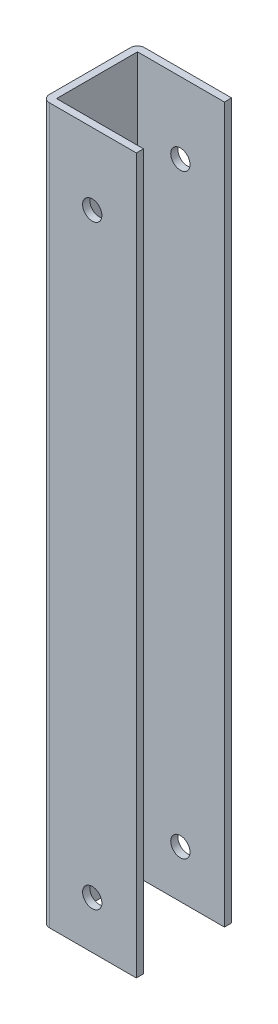
from build123d import *

# Parameters (mm, degrees)
SKETCH_1_W          = 74
SKETCH_1_H          = 34
EXTRUDE_1_DEPTH     = 300
SKETCH_2_W          = 41.646480438
SKETCH_2_H          = 42.526894273
CUT_EXTRUDE_1_DEPTH = 304.315017762
SKETCH_3_R          = 4.05
CUT_EXTRUDE_2_DEPTH = 306.286750449


with BuildPart() as part:
    # Эскиз1 → Вытянуть-Тонкостенный1 (new body)
    with BuildSketch(Plane(origin=(0, 0, 0), x_dir=(1, 0, 0), z_dir=(0, 1, 0))):
        with BuildLine():
            Line((40, 17), (40, -17))
            ThreePointArc((40, -17), (39.121320344, -19.121320344), (37, -20))
            Line((37, -20), (-37, -20))
            ThreePointArc((-37, -20), (-39.121320344, -19.121320344), (-40, -17))
            Line((-40, -17), (-40, 17))
            ThreePointArc((-40, 17), (-39.121320344, 19.121320344), (-37, 20))
            Line((-37, 20), (37, 20))
            ThreePointArc((37, 20), (39.121320344, 19.121320344), (40, 17))
        make_face()
        Rectangle(SKETCH_1_W, SKETCH_1_H, mode=Mode.SUBTRACT)
    extrude(amount=EXTRUDE_1_DEPTH)

    # Эскиз2 → Вырез-Вытянуть1 (cut, through all)
    with BuildSketch(Plane(origin=(0, 300, 0), x_dir=(1, 0, 0), z_dir=(0, 1, 0))):
        with Locations((20.323240219, -0.290673418)):
            Rectangle(SKETCH_2_W, SKETCH_2_H)
    extrude(amount=-CUT_EXTRUDE_1_DEPTH, mode=Mode.SUBTRACT)

    # Эскиз3 → Вырез-Вытянуть2 (cut, through all)
    with BuildSketch(Plane(origin=(0, 0, -20), x_dir=(-1, 0, 0), z_dir=(0, 0, -1))):
        with Locations((19, 270)):
            Circle(SKETCH_3_R)
        with Locations((19, 20)):
            Circle(SKETCH_3_R)
    extrude(amount=-CUT_EXTRUDE_2_DEPTH, mode=Mode.SUBTRACT)


solid = part.part
